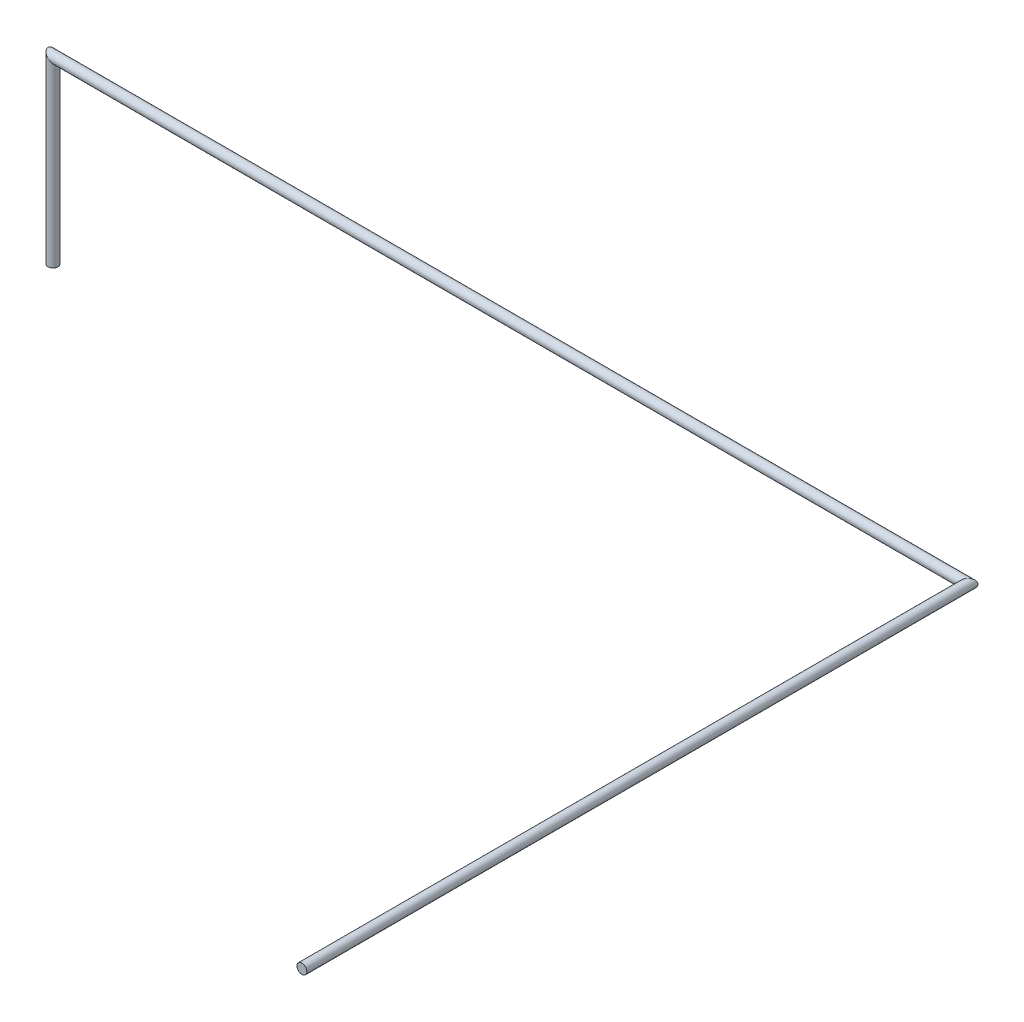
from build123d import *

# Parameters (mm, degrees)
CROQUIS1_R              = 12.7
SALIENTE_EXTRUIR1_DEPTH = 10
CROQUIS2_R              = 12.7
CROQUIS3_W              = 0.829521034
CROQUIS3_H              = 1.15927733
SALIENTE_EXTRUIR2_DEPTH = 3


with BuildPart() as part:
    # Croquis1 → Saliente-Extruir1 (new body)
    with BuildSketch(Plane(origin=(0, 0, 0), x_dir=(1, 0, 0), z_dir=(0, 1, 0))):
        Circle(CROQUIS1_R)
    extrude(amount=SALIENTE_EXTRUIR1_DEPTH)

    # Barrer1: sweep along a curve in space
    with BuildLine() as barrer1_path:
        Line((0, 10, 0), (0, 460, 0))
        Line((0, 460, 0), (2335, 460, 0))
        Line((2335, 460, 0), (2335, 460, 1700))
    # Croquis2 → Barrer1 (sweep)
    with BuildSketch(Plane(origin=(0, 10, 0), x_dir=(1, 0, 0), z_dir=(0, 1, 0))):
        Circle(CROQUIS2_R)
    sweep(path=barrer1_path.line, transition=Transition.RIGHT)

    # Croquis3 → Saliente-Extruir2 (add)
    with BuildSketch(Plane.XZ):
        with Locations((-12.7, 0)):
            Rectangle(CROQUIS3_W, CROQUIS3_H)
    extrude(amount=-SALIENTE_EXTRUIR2_DEPTH)


solid = part.part
